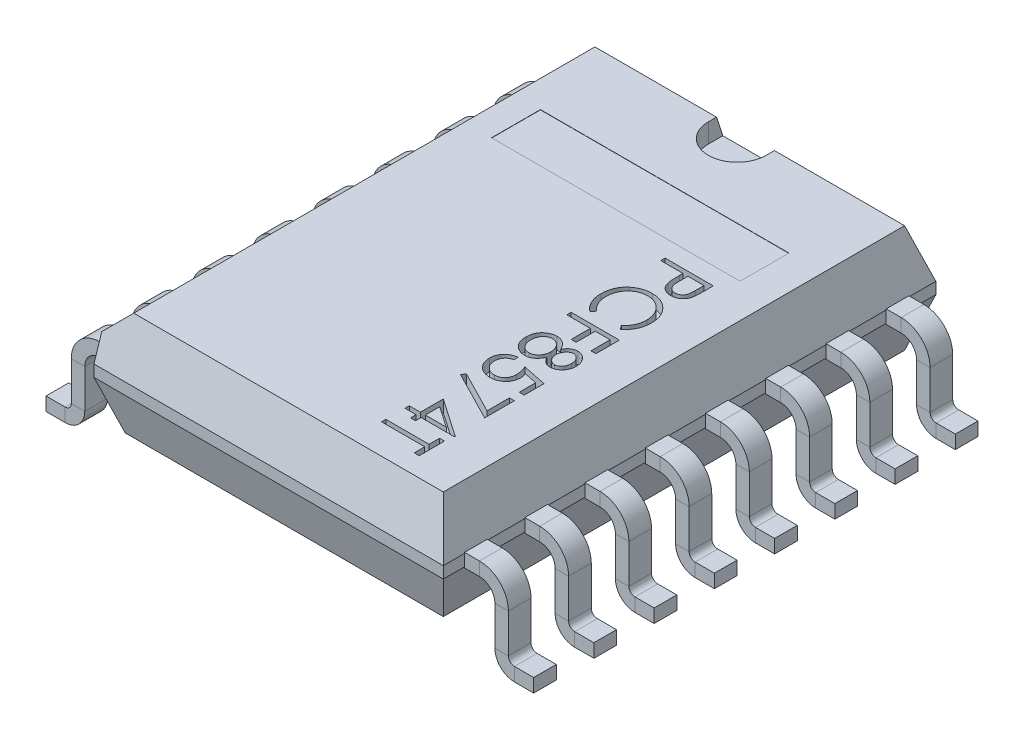
from build123d import *

# Parameters (mm, degrees)
SKETCH2_W               = 7.25
SKETCH2_H               = 10.22
BOSS_EXTRUDE1_DEPTH     = 0.24
SKETCH9_W               = 7.25
SKETCH9_H               = 10.22
BOSS_EXTRUDE3_DEPTH     = 1
SKETCH10_W              = 7.25
SKETCH10_H              = 10.22
BOSS_EXTRUDE4_DEPTH     = 1
BOSS_EXTRUDE4_TAPER     = 18
CUT_EXTRUDE1_DEPTH      = 0.4
CHAMFER1_START          = -5
CHAMFER1_DEPTH          = 8.625
CHAMFER1_START_2        = -6
CHAMFER1_2_DEPTH        = 12
CHAMFER2_START          = -4
CHAMFER2_OUTLINE_W      = 4
CHAMFER2_OUTLINE_H      = 12
CHAMFER2_DEPTH          = 0.9134789
SKETCH15_W              = 0.47
SKETCH15_H              = 0.28
LPATTERN1_COUNT         = 8
LPATTERN1_PITCH         = 1.25
MIRROR2_COPY_1_SKETCH_W = 0.47
MIRROR2_COPY_1_SKETCH_H = 0.28
MIRROR2_COPY_2_SKETCH_W = 0.47
MIRROR2_COPY_2_SKETCH_H = 0.28
MIRROR2_COPY_3_SKETCH_W = 0.47
MIRROR2_COPY_3_SKETCH_H = 0.28
MIRROR2_COPY_4_SKETCH_W = 0.47
MIRROR2_COPY_4_SKETCH_H = 0.28
MIRROR2_COPY_5_SKETCH_W = 0.47
MIRROR2_COPY_5_SKETCH_H = 0.28
MIRROR2_COPY_6_SKETCH_W = 0.47
MIRROR2_COPY_6_SKETCH_H = 0.28
MIRROR2_COPY_7_SKETCH_W = 0.47
MIRROR2_COPY_7_SKETCH_H = 0.28
SKETCH33_W              = 5.156105546
SKETCH33_H              = 1.012750295
CUT_EXTRUDE2_DEPTH      = 0.005
CUT_EXTRUDE3_DEPTH      = 0.25


with BuildPart() as part:
    # Sketch2 → Boss-Extrude1 (new body)
    with BuildSketch(Plane(origin=(0, 0, 0), x_dir=(1, 0, 0), z_dir=(0, 1, 0))):
        Rectangle(SKETCH2_W, SKETCH2_H)
    extrude(amount=BOSS_EXTRUDE1_DEPTH)

    # Sketch10 → Boss-Extrude4 (add)
    with BuildSketch(Plane.XZ):
        Rectangle(SKETCH10_W, SKETCH10_H)
    extrude(amount=BOSS_EXTRUDE4_DEPTH, taper=BOSS_EXTRUDE4_TAPER)



with BuildPart() as body_2:
    # Sketch9 → Boss-Extrude3 (new body)
    with BuildSketch(Plane(origin=(0, 0.24, 0), x_dir=(1, 0, 0), z_dir=(0, 1, 0))):
        Rectangle(SKETCH9_W, SKETCH9_H)
    extrude(amount=BOSS_EXTRUDE3_DEPTH)

    # Sketch12 → Cut-Extrude1 (cut)
    with BuildSketch(Plane(origin=(0, 1.24, 0), x_dir=(1, 0, 0), z_dir=(0, 1, 0))):
        with BuildLine():
            Line((0.600954319, 4.613520836), (0.600954319, 5.468733616))
            Line((0.600954319, 5.468733616), (-0.600954319, 5.468733616))
            Line((-0.600954319, 5.468733616), (-0.600954319, 4.613520836))
            ThreePointArc((-0.600954319, 4.613520836), (0, 4.012566516), (0.600954319, 4.613520836))
        make_face()
    extrude(amount=-CUT_EXTRUDE1_DEPTH, mode=Mode.SUBTRACT)

    # Chamfer1: read off the stored shape, not the designer's step
    # Chamfer1 outline → Chamfer1 (cut)
    with BuildSketch(Plane.YZ.offset(CHAMFER1_START)):
        Polygon((0.24, 5.11), (1.24, 4.785080304), (1.24, 5.11), align=None)
        Polygon((0.24, -5.11), (1.24, -5.11), (1.24, -4.785080304), align=None)
    extrude(amount=CHAMFER1_DEPTH, mode=Mode.SUBTRACT)

    # Chamfer1 2 outline → Chamfer1 2 (cut)
    with BuildSketch(Plane.XY.offset(CHAMFER1_START_2)):
        Polygon((3.300080304, 1.24), (3.625, 0.24), (3.625, 1.24), align=None)
    extrude(amount=CHAMFER1_2_DEPTH, mode=Mode.SUBTRACT)

    # Chamfer2: read off the stored shape, not the designer's step
    # Chamfer2 outline → Chamfer2 (cut)
    with BuildSketch(Plane(origin=(0, 0, 0), x_dir=(0.7071067811865471, 0.707106781186548, 0), z_dir=(0.707106781186548, -0.707106781186547, 0)).offset(CHAMFER2_START)):
        with Locations((-2, 0)):
            Rectangle(CHAMFER2_OUTLINE_W, CHAMFER2_OUTLINE_H)
    extrude(amount=CHAMFER2_DEPTH, mode=Mode.SUBTRACT)


with BuildPart() as part_1:
    add(part.part)

    add(body_2.part)  # Sweep1 merges body 2
    # Sweep1: sweep along a path in Sketch24
    with BuildLine(Plane.XY.offset(5.11)) as sweep1_path:
        Line((5.059235568, -1.412519405), (4.660907902, -1.412519405))
        ThreePointArc((4.660907902, -1.412519405), (4.472802819, -1.334603729), (4.394887143, -1.146498646))
        Line((4.394887143, -1.146498646), (4.394887143, -0.33960765))
        ThreePointArc((4.394887143, -0.33960765), (4.260271179, -0.014615964), (3.935279493, 0.12))
        Line((3.935279493, 0.12), (3.625, 0.12))
    # Sketch15 → Sweep1 (sweep)
    with BuildSketch(Plane(origin=(3.625, 0, 0), x_dir=(0, 0, -1), z_dir=(1, 0, 0))):
        with Locations((-4.435, 0.12)):
            Rectangle(SKETCH15_W, SKETCH15_H)
    sweep1 = sweep(path=sweep1_path.line)

    # LPattern1: Sweep1 ×8
    with Locations(*[(0, 0, -i * LPATTERN1_PITCH) for i in range(1, LPATTERN1_COUNT)]):
        add(sweep1)

    # Mirror2: Sweep1 across plane
    add(sweep1.mirror(Plane(origin=(0, 0, 0), x_dir=(0, 0, 1), z_dir=(1, 0, 0))))

    # Mirror2 copy 1: sweep along a path in Mirror2 copy 1 path
    with BuildLine(Plane(origin=(0, 0, 3.86), x_dir=(-1, 0, 0), z_dir=(0, 0, 1))) as mirror2_copy_1_path:
        Line((5.059235568, 1.412519405), (4.660907902, 1.412519405))
        ThreePointArc((4.660907902, 1.412519405), (4.472802819, 1.334603729), (4.394887143, 1.146498646))
        Line((4.394887143, 1.146498646), (4.394887143, 0.33960765))
        ThreePointArc((4.394887143, 0.33960765), (4.260271179, 0.014615964), (3.935279493, -0.12))
        Line((3.935279493, -0.12), (3.625, -0.12))
    # Mirror2 copy 1 sketch → Mirror2 copy 1 (sweep)
    with BuildSketch(Plane(origin=(-3.625, 0, -1.25), x_dir=(0, 0, -1), z_dir=(-1, 0, 0))):
        with Locations((-4.435, -0.12)):
            Rectangle(MIRROR2_COPY_1_SKETCH_W, MIRROR2_COPY_1_SKETCH_H)
    sweep(path=mirror2_copy_1_path.line)

    # Mirror2 copy 2: sweep along a path in Mirror2 copy 2 path
    with BuildLine(Plane(origin=(0, 0, 2.61), x_dir=(-1, 0, 0), z_dir=(0, 0, 1))) as mirror2_copy_2_path:
        Line((5.059235568, 1.412519405), (4.660907902, 1.412519405))
        ThreePointArc((4.660907902, 1.412519405), (4.472802819, 1.334603729), (4.394887143, 1.146498646))
        Line((4.394887143, 1.146498646), (4.394887143, 0.33960765))
        ThreePointArc((4.394887143, 0.33960765), (4.260271179, 0.014615964), (3.935279493, -0.12))
        Line((3.935279493, -0.12), (3.625, -0.12))
    # Mirror2 copy 2 sketch → Mirror2 copy 2 (sweep)
    with BuildSketch(Plane(origin=(-3.625, 0, -2.5), x_dir=(0, 0, -1), z_dir=(-1, 0, 0))):
        with Locations((-4.435, -0.12)):
            Rectangle(MIRROR2_COPY_2_SKETCH_W, MIRROR2_COPY_2_SKETCH_H)
    sweep(path=mirror2_copy_2_path.line)

    # Mirror2 copy 3: sweep along a path in Mirror2 copy 3 path
    with BuildLine(Plane(origin=(0, 0, 1.36), x_dir=(-1, 0, 0), z_dir=(0, 0, 1))) as mirror2_copy_3_path:
        Line((5.059235568, 1.412519405), (4.660907902, 1.412519405))
        ThreePointArc((4.660907902, 1.412519405), (4.472802819, 1.334603729), (4.394887143, 1.146498646))
        Line((4.394887143, 1.146498646), (4.394887143, 0.33960765))
        ThreePointArc((4.394887143, 0.33960765), (4.260271179, 0.014615964), (3.935279493, -0.12))
        Line((3.935279493, -0.12), (3.625, -0.12))
    # Mirror2 copy 3 sketch → Mirror2 copy 3 (sweep)
    with BuildSketch(Plane(origin=(-3.625, 0, -3.75), x_dir=(0, 0, -1), z_dir=(-1, 0, 0))):
        with Locations((-4.435, -0.12)):
            Rectangle(MIRROR2_COPY_3_SKETCH_W, MIRROR2_COPY_3_SKETCH_H)
    sweep(path=mirror2_copy_3_path.line)

    # Mirror2 copy 4: sweep along a path in Mirror2 copy 4 path
    with BuildLine(Plane(origin=(0, 0, 0.11), x_dir=(-1, 0, 0), z_dir=(0, 0, 1))) as mirror2_copy_4_path:
        Line((5.059235568, 1.412519405), (4.660907902, 1.412519405))
        ThreePointArc((4.660907902, 1.412519405), (4.472802819, 1.334603729), (4.394887143, 1.146498646))
        Line((4.394887143, 1.146498646), (4.394887143, 0.33960765))
        ThreePointArc((4.394887143, 0.33960765), (4.260271179, 0.014615964), (3.935279493, -0.12))
        Line((3.935279493, -0.12), (3.625, -0.12))
    # Mirror2 copy 4 sketch → Mirror2 copy 4 (sweep)
    with BuildSketch(Plane(origin=(-3.625, 0, -5), x_dir=(0, 0, -1), z_dir=(-1, 0, 0))):
        with Locations((-4.435, -0.12)):
            Rectangle(MIRROR2_COPY_4_SKETCH_W, MIRROR2_COPY_4_SKETCH_H)
    sweep(path=mirror2_copy_4_path.line)

    # Mirror2 copy 5: sweep along a path in Mirror2 copy 5 path
    with BuildLine(Plane(origin=(0, 0, -1.14), x_dir=(-1, 0, 0), z_dir=(0, 0, 1))) as mirror2_copy_5_path:
        Line((5.059235568, 1.412519405), (4.660907902, 1.412519405))
        ThreePointArc((4.660907902, 1.412519405), (4.472802819, 1.334603729), (4.394887143, 1.146498646))
        Line((4.394887143, 1.146498646), (4.394887143, 0.33960765))
        ThreePointArc((4.394887143, 0.33960765), (4.260271179, 0.014615964), (3.935279493, -0.12))
        Line((3.935279493, -0.12), (3.625, -0.12))
    # Mirror2 copy 5 sketch → Mirror2 copy 5 (sweep)
    with BuildSketch(Plane(origin=(-3.625, 0, -6.25), x_dir=(0, 0, -1), z_dir=(-1, 0, 0))):
        with Locations((-4.435, -0.12)):
            Rectangle(MIRROR2_COPY_5_SKETCH_W, MIRROR2_COPY_5_SKETCH_H)
    sweep(path=mirror2_copy_5_path.line)

    # Mirror2 copy 6: sweep along a path in Mirror2 copy 6 path
    with BuildLine(Plane(origin=(0, 0, -2.39), x_dir=(-1, 0, 0), z_dir=(0, 0, 1))) as mirror2_copy_6_path:
        Line((5.059235568, 1.412519405), (4.660907902, 1.412519405))
        ThreePointArc((4.660907902, 1.412519405), (4.472802819, 1.334603729), (4.394887143, 1.146498646))
        Line((4.394887143, 1.146498646), (4.394887143, 0.33960765))
        ThreePointArc((4.394887143, 0.33960765), (4.260271179, 0.014615964), (3.935279493, -0.12))
        Line((3.935279493, -0.12), (3.625, -0.12))
    # Mirror2 copy 6 sketch → Mirror2 copy 6 (sweep)
    with BuildSketch(Plane(origin=(-3.625, 0, -7.5), x_dir=(0, 0, -1), z_dir=(-1, 0, 0))):
        with Locations((-4.435, -0.12)):
            Rectangle(MIRROR2_COPY_6_SKETCH_W, MIRROR2_COPY_6_SKETCH_H)
    sweep(path=mirror2_copy_6_path.line)

    # Mirror2 copy 7: sweep along a path in Mirror2 copy 7 path
    with BuildLine(Plane(origin=(0, 0, -3.64), x_dir=(-1, 0, 0), z_dir=(0, 0, 1))) as mirror2_copy_7_path:
        Line((5.059235568, 1.412519405), (4.660907902, 1.412519405))
        ThreePointArc((4.660907902, 1.412519405), (4.472802819, 1.334603729), (4.394887143, 1.146498646))
        Line((4.394887143, 1.146498646), (4.394887143, 0.33960765))
        ThreePointArc((4.394887143, 0.33960765), (4.260271179, 0.014615964), (3.935279493, -0.12))
        Line((3.935279493, -0.12), (3.625, -0.12))
    # Mirror2 copy 7 sketch → Mirror2 copy 7 (sweep)
    with BuildSketch(Plane(origin=(-3.625, 0, -8.75), x_dir=(0, 0, -1), z_dir=(-1, 0, 0))):
        with Locations((-4.435, -0.12)):
            Rectangle(MIRROR2_COPY_7_SKETCH_W, MIRROR2_COPY_7_SKETCH_H)
    sweep(path=mirror2_copy_7_path.line)

    # Sketch33 → Cut-Extrude2 (cut)
    with BuildSketch(Plane(origin=(0, 1.24, 0), x_dir=(1, 0, 0), z_dir=(0, 1, 0))):
        with Locations((0.014185998, 2.586896118)):
            Rectangle(SKETCH33_W, SKETCH33_H)
    extrude(amount=-CUT_EXTRUDE2_DEPTH, mode=Mode.SUBTRACT)

    # Sketch36 → Cut-Extrude3 (cut)
    # profile 1 of 8: a face of its own
    with BuildSketch(Plane(origin=(0, 1.24, 0), x_dir=(1, 0, 0), z_dir=(0, 1, 0))):
        with BuildLine():
            Line((2.398118187, 1.718553058), (2.398118187, 1.522439276))
            add(Edge.make_bspline(
                [(2.398118187, 1.522439276), (2.39810336, 1.508950446), (2.39807495, 1.483105248), (2.397213594, 1.446043804), (2.39606311, 1.41238388), (2.394468284, 1.382198057), (2.392583543, 1.355393458), (2.389940104, 1.332091372), (2.387180019, 1.312108642), (2.384373903, 1.30013537), (2.383094149, 1.294674853)],
                knots=[0, 0, 0, 0, 1.415646017, 2.712440637, 3.8905458, 4.950247383, 5.884950622, 6.709939814, 7.411656543, 8, 8, 8, 8], degree=3))
            add(Edge.make_bspline(
                [(2.383094149, 1.294674853), (2.38120218, 1.287762399), (2.377462824, 1.274100373), (2.369972945, 1.254414597), (2.361093233, 1.23568405), (2.350968755, 1.217849702), (2.339185271, 1.201111414), (2.326115524, 1.185254925), (2.311766705, 1.170189287), (2.295860652, 1.156426275), (2.278983817, 1.143755656), (2.260760342, 1.132886186), (2.241586856, 1.12369205), (2.221266998, 1.116183241), (2.199924266, 1.11047365), (2.177496355, 1.106255223), (2.154060329, 1.103556222), (2.138042883, 1.103299255), (2.129889021, 1.103168443)],
                knots=[0, 0, 0, 0, 0.999487232, 1.975422798, 2.933948774, 3.889618007, 4.832992075, 5.786114792, 6.754729845, 7.731954186, 8.717668599, 9.695514499, 10.68728626, 11.680675814, 12.71351902, 13.766008651, 14.862761406, 16, 16, 16, 16], degree=3))
            add(Edge.make_bspline(
                [(2.129889021, 1.103168443), (2.121666799, 1.10328885), (2.105579466, 1.103524435), (2.082044384, 1.106351945), (2.059553415, 1.110160571), (2.038156429, 1.116016872), (2.017980495, 1.123687064), (1.998717286, 1.132684793), (1.980694522, 1.143537231), (1.963846774, 1.156007182), (1.948158228, 1.169879066), (1.933742572, 1.185094191), (1.92068419, 1.201591132), (1.908953806, 1.21931746), (1.898823441, 1.238445988), (1.889749925, 1.258686603), (1.882129622, 1.280215237), (1.878121033, 1.295113098), (1.876082931, 1.302687674)],
                knots=[0, 0, 0, 0, 1.121902311, 2.195077645, 3.232258892, 4.234102512, 5.217864754, 6.176164875, 7.132989551, 8.084763148, 9.034132444, 9.988522005, 10.94243251, 11.903244335, 12.886203696, 13.894208494, 14.929344452, 16, 16, 16, 16], degree=3))
            add(Edge.make_bspline(
                [(1.876082931, 1.302687674), (1.87475065, 1.308952626), (1.871830881, 1.322682634), (1.868571322, 1.345294841), (1.86578915, 1.371622094), (1.863703111, 1.401628459), (1.861917291, 1.435287004), (1.860497836, 1.472615934), (1.859717877, 1.513688528), (1.859677651, 1.542337455), (1.859656649, 1.557295046)],
                knots=[0, 0, 0, 0, 0.601384939, 1.31797006, 2.144135048, 3.087295005, 4.142315834, 5.309527816, 6.595305764, 8, 8, 8, 8], degree=3))
            Line((1.859656649, 1.557295046), (1.859656649, 1.628809469))
            Line((1.859656649, 1.628809469), (1.398118187, 1.628809469))
            Line((1.398118187, 1.628809469), (1.398118187, 1.718553058))
            Line((1.398118187, 1.718553058), (2.398118187, 1.718553058))
        make_face()
        with BuildLine():
            Line((2.295554085, 1.628809469), (1.962220751, 1.628809469))
            Line((1.962220751, 1.628809469), (1.960017226, 1.45372934))
            add(Edge.make_bspline(
                [(1.960017226, 1.45372934), (1.96001188, 1.445180707), (1.96000156, 1.428677745), (1.961155818, 1.404773365), (1.962429043, 1.382652509), (1.964422967, 1.362267137), (1.96705015, 1.343773036), (1.969909788, 1.326932655), (1.973784029, 1.311992529), (1.979186042, 1.294485437), (1.988219715, 1.27504341), (2.001670194, 1.254032972), (2.018344498, 1.235938703), (2.037349808, 1.22038532), (2.058569308, 1.20833149), (2.081094798, 1.199265473), (2.104940451, 1.19398457), (2.121250107, 1.193271976), (2.12948838, 1.192912033)],
                knots=[0, 0, 0, 0, 1.160368111, 2.240066715, 3.248291599, 4.168343349, 5.019594299, 5.784185847, 6.485545725, 7.113397927, 8.269509094, 9.383373363, 10.487084095, 11.595623793, 12.704274681, 13.786671823, 14.88201193, 16, 16, 16, 16], degree=3))
            add(Edge.make_bspline(
                [(2.12948838, 1.192912033), (2.13752733, 1.193273898), (2.153507769, 1.19399324), (2.176939489, 1.199307128), (2.199225992, 1.208313792), (2.220184254, 1.220466999), (2.239111784, 1.235573795), (2.255409774, 1.253267078), (2.268689775, 1.273185563), (2.277202115, 1.291723617), (2.282408155, 1.308179637), (2.286049132, 1.322474837), (2.288956577, 1.338614917), (2.29131068, 1.356605746), (2.293325967, 1.376307688), (2.294693386, 1.397890067), (2.295493803, 1.421271107), (2.295533504, 1.437502699), (2.295554085, 1.44591684)],
                knots=[0, 0, 0, 0, 1.120550889, 2.227516482, 3.330715807, 4.461473166, 5.594337325, 6.694900473, 7.802844763, 8.919519911, 9.52614448, 10.208195984, 10.975273469, 11.811520316, 12.738076669, 13.736566072, 14.826679847, 16, 16, 16, 16], degree=3))
            Line((2.295554085, 1.44591684), (2.295554085, 1.628809469))
        make_face(mode=Mode.SUBTRACT)
    # profile 2 of 8: a face of its own
    with BuildSketch(Plane(origin=(0, 1.24, 0), x_dir=(1, 0, 0), z_dir=(0, 1, 0))):
        with BuildLine():
            Line((2.214624597, -0.025036685), (2.154528444, 0.053488956))
            add(Edge.make_bspline(
                [(2.154528444, 0.053488956), (2.161204435, 0.059090638), (2.174466411, 0.07021848), (2.193089138, 0.088121109), (2.210536355, 0.106778722), (2.226891178, 0.126184185), (2.241581683, 0.14668679), (2.255373426, 0.167789876), (2.267735637, 0.18984646), (2.282725062, 0.220346956), (2.29836682, 0.260246341), (2.311482029, 0.310473438), (2.319830937, 0.36290518), (2.320735177, 0.398675923), (2.32119511, 0.416870366)],
                knots=[0, 0, 0, 0, 0.757959112, 1.505699292, 2.245454638, 2.979532153, 3.711538275, 4.438200793, 5.171680507, 5.909471876, 7.393775596, 8.890124382, 10.418191784, 12, 12, 12, 12], degree=3))
            add(Edge.make_bspline(
                [(2.32119511, 0.416870366), (2.321079172, 0.426894044), (2.32084837, 0.446848371), (2.317824877, 0.476464019), (2.313526381, 0.505582742), (2.307303416, 0.53409626), (2.299201679, 0.561947956), (2.289700505, 0.589349899), (2.277877257, 0.615979366), (2.264820059, 0.642156838), (2.250067825, 0.667235454), (2.233982035, 0.690969162), (2.21672057, 0.713249533), (2.198327986, 0.734138306), (2.1785757, 0.753406391), (2.157696075, 0.771362588), (2.135437799, 0.787683284), (2.112218307, 0.802769531), (2.08800347, 0.816193593), (2.06294562, 0.827785921), (2.037140563, 0.837721509), (2.010535435, 0.845656181), (1.983234933, 0.851914752), (1.955181121, 0.856238457), (1.926428451, 0.859234751), (1.906940102, 0.859463429), (1.897116585, 0.859578699)],
                knots=[0, 0, 0, 0, 1.055000685, 2.100209969, 3.131349012, 4.153242145, 5.170189196, 6.184191144, 7.204341339, 8.235672124, 9.263040994, 10.265373269, 11.252624173, 12.22887325, 13.193405896, 14.155809299, 15.126090485, 16.097288279, 17.069732292, 18.038585918, 19.002221264, 19.978698174, 20.959418239, 21.948869816, 22.966084182, 24, 24, 24, 24], degree=3))
            add(Edge.make_bspline(
                [(1.897116585, 0.859578699), (1.882336208, 0.85921818), (1.853316898, 0.858510347), (1.810811009, 0.852210823), (1.770090816, 0.84263794), (1.731410861, 0.828290632), (1.694294188, 0.810599475), (1.659368801, 0.788245014), (1.626106925, 0.762354575), (1.595294655, 0.732561884), (1.567147876, 0.699874508), (1.542361996, 0.664803676), (1.521700601, 0.627436737), (1.504507473, 0.588186271), (1.491291265, 0.546750238), (1.48198723, 0.503203152), (1.475918035, 0.457639725), (1.475336982, 0.42650561), (1.475041264, 0.41066043)],
                knots=[0, 0, 0, 0, 1.029171465, 2.020641659, 2.987623507, 3.938342917, 4.889210282, 5.84687017, 6.821220943, 7.821438502, 8.827599549, 9.822697543, 10.807740252, 11.797342354, 12.80366471, 13.83203677, 14.896651826, 16, 16, 16, 16], degree=3))
            add(Edge.make_bspline(
                [(1.475041264, 0.41066043), (1.475523773, 0.393202519), (1.476473465, 0.358841174), (1.484518965, 0.308450309), (1.497564084, 0.260211519), (1.515820633, 0.214122208), (1.539553573, 0.170312309), (1.568324395, 0.128713264), (1.602406775, 0.089289958), (1.628430526, 0.065583877), (1.641707931, 0.053488956)],
                knots=[0, 0, 0, 0, 1.028121516, 2.023589091, 2.998037872, 3.967518031, 4.937445131, 5.927275754, 6.942489185, 8, 8, 8, 8], degree=3))
            Line((1.641707931, 0.053488956), (1.582212738, -0.025036685))
            add(Edge.make_bspline(
                [(1.582212738, -0.025036685), (1.574058881, -0.018717234), (1.557790223, -0.0061086), (1.534855655, 0.0143081), (1.513282302, 0.035815435), (1.493248712, 0.058575938), (1.474336663, 0.082317395), (1.457180168, 0.107457999), (1.441256611, 0.133563523), (1.426869058, 0.160785958), (1.413969039, 0.189035927), (1.403078485, 0.218284033), (1.393562173, 0.248282484), (1.385784967, 0.279046386), (1.379705048, 0.310678515), (1.375642961, 0.343070338), (1.372859374, 0.376290233), (1.372605709, 0.398702077), (1.372477162, 0.410059469)],
                knots=[0, 0, 0, 0, 0.986756325, 1.968786143, 2.935506311, 3.899499537, 4.868307269, 5.8376204, 6.809456583, 7.792545619, 8.781780509, 9.778496008, 10.776623214, 11.79151764, 12.812666265, 13.856269958, 14.913646641, 16, 16, 16, 16], degree=3))
            add(Edge.make_bspline(
                [(1.372477162, 0.410059469), (1.372552017, 0.420814802), (1.372700033, 0.442082142), (1.375097795, 0.473481785), (1.378369149, 0.504050237), (1.3832949, 0.53370013), (1.389107569, 0.562593266), (1.396899357, 0.590467719), (1.40562769, 0.617597779), (1.415886257, 0.643874448), (1.42746231, 0.669320076), (1.440545612, 0.693852594), (1.455026145, 0.717460717), (1.470584719, 0.740376552), (1.487721091, 0.762261576), (1.506197273, 0.78330544), (1.52595099, 0.803626147), (1.540195234, 0.816198343), (1.547356969, 0.822519405)],
                knots=[0, 0, 0, 0, 1.114604814, 2.203992996, 3.262667896, 4.300477797, 5.318619304, 6.316056647, 7.298880507, 8.271930387, 9.238335007, 10.195173496, 11.151986948, 12.108099108, 13.064862484, 14.031167946, 15.010108607, 16, 16, 16, 16], degree=3))
            add(Edge.make_bspline(
                [(1.547356969, 0.822519405), (1.559797309, 0.832643874), (1.584527798, 0.852770582), (1.624609507, 0.878520777), (1.666457566, 0.900562936), (1.710291832, 0.918384627), (1.756013942, 0.932316837), (1.803646946, 0.941968607), (1.853146358, 0.948240494), (1.886814012, 0.948957719), (1.903927482, 0.949322289)],
                knots=[0, 0, 0, 0, 0.994628077, 1.977248131, 2.950237994, 3.925870899, 4.908910175, 5.911660606, 6.938484602, 8, 8, 8, 8], degree=3))
            add(Edge.make_bspline(
                [(1.903927482, 0.949322289), (1.921914002, 0.948875961), (1.957301357, 0.947997837), (2.009247513, 0.940598833), (2.05894399, 0.928551825), (2.106582006, 0.911963014), (2.151888997, 0.890077937), (2.195056312, 0.863584281), (2.236048704, 0.832223268), (2.274342082, 0.796388761), (2.309352393, 0.757081737), (2.340154409, 0.714991189), (2.365787921, 0.670196204), (2.387215413, 0.623191142), (2.403685255, 0.573623794), (2.415214738, 0.521599977), (2.422391057, 0.467217429), (2.423298259, 0.430113879), (2.423759213, 0.411261392)],
                knots=[0, 0, 0, 0, 1.032901378, 2.032168977, 3.007206631, 3.966850309, 4.924221947, 5.891988639, 6.871730993, 7.884084801, 8.900290346, 9.89161143, 10.874607481, 11.860025555, 12.854717796, 13.869097222, 14.917278314, 16, 16, 16, 16], degree=3))
            add(Edge.make_bspline(
                [(2.423759213, 0.411261392), (2.423621562, 0.39977152), (2.423349096, 0.377028476), (2.420688706, 0.343385188), (2.416261733, 0.310629037), (2.410196481, 0.278680809), (2.402762515, 0.247424653), (2.393030878, 0.217181232), (2.381730063, 0.187785861), (2.369046519, 0.159216523), (2.354546321, 0.131784045), (2.338797587, 0.105493419), (2.321436782, 0.080661794), (2.303037856, 0.056822084), (2.282912567, 0.034510997), (2.261716312, 0.013091334), (2.238820123, -0.006696989), (2.222704536, -0.018912263), (2.214624597, -0.025036685)],
                knots=[0, 0, 0, 0, 1.096705196, 2.170817488, 3.219277236, 4.250701065, 5.274195539, 6.284202015, 7.28098643, 8.279664616, 9.266225751, 10.241373748, 11.203306326, 12.157093976, 13.114198862, 14.069774147, 15.032234603, 16, 16, 16, 16], degree=3))
        make_face()
    # profile 3 of 8: a face of its own
    with BuildSketch(Plane(origin=(0, 1.24, 0), x_dir=(1, 0, 0), z_dir=(0, 1, 0))):
        Polygon((2.398118187, -0.23016489), (2.398118187, -0.717344377), (2.295554085, -0.717344377), (2.295554085, -0.31990848), (1.987861777, -0.31990848), (1.987861777, -0.717344377), (1.885297674, -0.717344377), (1.885297674, -0.31990848), (1.398118187, -0.31990848), (1.398118187, -0.23016489), align=None)
    # profile 4 of 8: a face of its own
    with BuildSketch(Plane(origin=(0, 1.24, 0), x_dir=(1, 0, 0), z_dir=(0, 1, 0))):
        with BuildLine():
            add(Edge.make_bspline(
                [(1.955209533, -1.293265852), (1.950936328, -1.301381951), (1.942576082, -1.317260569), (1.929157929, -1.339979859), (1.91514091, -1.36089713), (1.90096503, -1.38031048), (1.886069958, -1.397823942), (1.870625713, -1.413553404), (1.855045996, -1.427992339), (1.8387212, -1.44038164), (1.821988026, -1.451306723), (1.804702637, -1.460735691), (1.786919554, -1.468798563), (1.768440266, -1.475187758), (1.749537387, -1.480451186), (1.729966521, -1.484072772), (1.709856713, -1.486020467), (1.696265769, -1.486388698), (1.689384213, -1.486575147)],
                knots=[0, 0, 0, 0, 1.264385854, 2.473688339, 3.635349404, 4.734491366, 5.785876313, 6.801388178, 7.772322209, 8.711311751, 9.622826105, 10.524996139, 11.423212571, 12.31118177, 13.217849097, 14.126010572, 15.051135535, 16, 16, 16, 16], degree=3))
            add(Edge.make_bspline(
                [(1.689384213, -1.486575147), (1.679755628, -1.486356701), (1.660697046, -1.485924316), (1.632579198, -1.482095816), (1.605206066, -1.476508201), (1.57884229, -1.467807075), (1.553157498, -1.457414122), (1.528621316, -1.444044197), (1.504547652, -1.429040228), (1.489743614, -1.416964357), (1.482252803, -1.410853993)],
                knots=[0, 0, 0, 0, 1.02534174, 2.029536028, 3.018826961, 3.997522084, 4.983122576, 5.966563916, 6.971085759, 8, 8, 8, 8], degree=3))
            add(Edge.make_bspline(
                [(1.482252803, -1.410853993), (1.473511724, -1.402900715), (1.456137583, -1.387092439), (1.433580209, -1.360011602), (1.414623239, -1.330291064), (1.399174127, -1.298045826), (1.387149596, -1.263362083), (1.378508876, -1.226247224), (1.373559611, -1.186628895), (1.372844185, -1.15939876), (1.372477162, -1.145429313)],
                knots=[0, 0, 0, 0, 0.954267603, 1.896743057, 2.838368354, 3.796610408, 4.779680527, 5.799409237, 6.871065594, 8, 8, 8, 8], degree=3))
            add(Edge.make_bspline(
                [(1.372477162, -1.145429313), (1.372807325, -1.131997226), (1.373449788, -1.105859748), (1.377778889, -1.067810382), (1.385443051, -1.032299334), (1.395716114, -0.999158248), (1.409415476, -0.968707557), (1.426206934, -0.940892006), (1.445711216, -0.915303504), (1.468398378, -0.892746278), (1.492701305, -0.872721295), (1.517773021, -0.85513035), (1.543616881, -0.840509203), (1.569847261, -0.828130028), (1.596831879, -0.818653452), (1.624431882, -0.812089963), (1.652599066, -0.807921587), (1.67160811, -0.807366977), (1.681171072, -0.807087967)],
                knots=[0, 0, 0, 0, 1.256882982, 2.445766618, 3.576898315, 4.651879663, 5.686612882, 6.692806257, 7.686348993, 8.689277895, 9.678883454, 10.630458183, 11.551151498, 12.454054546, 13.341321255, 14.221808008, 15.105437234, 16, 16, 16, 16], degree=3))
            add(Edge.make_bspline(
                [(1.681171072, -0.807087967), (1.688187989, -0.807253068), (1.702055894, -0.807579366), (1.722544197, -0.809838009), (1.742486235, -0.813468571), (1.761953966, -0.818401423), (1.780811947, -0.825078723), (1.799126072, -0.833169759), (1.817037054, -0.842512673), (1.834236982, -0.853711178), (1.851299072, -0.866040187), (1.867389943, -0.880665195), (1.883405985, -0.8967054), (1.898654185, -0.914815704), (1.913867432, -0.934441796), (1.928077578, -0.956178527), (1.942324339, -0.979415196), (1.950840775, -0.995931264), (1.955209533, -1.004403672)],
                knots=[0, 0, 0, 0, 0.941717298, 1.86116577, 2.762973304, 3.660719123, 4.553575492, 5.444450535, 6.34648071, 7.261375261, 8.197060099, 9.168336537, 10.175980388, 11.237504102, 12.343496232, 13.506792996, 14.721035322, 16, 16, 16, 16], degree=3))
            add(Edge.make_bspline(
                [(1.955209533, -1.004403672), (1.961532768, -0.992804935), (1.973776319, -0.970346534), (1.996288752, -0.940628681), (2.02058192, -0.915061298), (2.047458719, -0.894635231), (2.075735394, -0.87842698), (2.105321333, -0.866981272), (2.135862272, -0.859507083), (2.15668899, -0.858750162), (2.167148636, -0.858370019)],
                knots=[0, 0, 0, 0, 1.16709546, 2.25982348, 3.287408737, 4.277418348, 5.234967981, 6.16072867, 7.076276605, 8, 8, 8, 8], degree=3))
            add(Edge.make_bspline(
                [(2.167148636, -0.858370019), (2.17780507, -0.858837292), (2.199226361, -0.859776592), (2.231113998, -0.867371687), (2.262432319, -0.879749408), (2.293033857, -0.896581766), (2.321866116, -0.917558078), (2.347812668, -0.942718954), (2.370344606, -0.971633877), (2.389380325, -1.00378946), (2.404950367, -1.038326161), (2.415579081, -1.074828361), (2.422569783, -1.112643756), (2.423359034, -1.138386453), (2.423759213, -1.151438929)],
                knots=[0, 0, 0, 0, 0.888753872, 1.786550278, 2.720173491, 3.693036334, 4.694165094, 5.687489879, 6.699912706, 7.744713188, 8.800178723, 9.852977058, 10.911381959, 12, 12, 12, 12], degree=3))
            add(Edge.make_bspline(
                [(2.423759213, -1.151438929), (2.423347742, -1.164154763), (2.422536368, -1.18922894), (2.415702935, -1.226140724), (2.404416726, -1.261487511), (2.389049153, -1.295076423), (2.369885327, -1.326173553), (2.347126082, -1.353938476), (2.321270699, -1.37829349), (2.292516525, -1.39852883), (2.261915729, -1.414858927), (2.23009034, -1.42648845), (2.197466825, -1.433885775), (2.175400085, -1.43482335), (2.164344149, -1.435293095)],
                knots=[0, 0, 0, 0, 1.072712831, 2.115267497, 3.156282165, 4.197922255, 5.225560591, 6.230883479, 7.219814004, 8.214446311, 9.19021444, 10.138875805, 11.067534608, 12, 12, 12, 12], degree=3))
            add(Edge.make_bspline(
                [(2.164344149, -1.435293095), (2.153493609, -1.43488328), (2.132183766, -1.434078425), (2.101119963, -1.427306174), (2.072024528, -1.415905505), (2.044588103, -1.400323854), (2.019190286, -1.380047194), (1.995915521, -1.35511026), (1.973838579, -1.326286949), (1.961558021, -1.304518926), (1.955209533, -1.293265852)],
                knots=[0, 0, 0, 0, 0.975287281, 1.915408787, 2.843441052, 3.776938647, 4.743139116, 5.754296123, 6.83907365, 8, 8, 8, 8], degree=3))
        make_face()
        with BuildLine():
            add(Edge.make_bspline(
                [(2.32119511, -1.146430916), (2.321008984, -1.1394164), (2.320644841, -1.12569294), (2.318742373, -1.105570462), (2.315041454, -1.0864355), (2.310116108, -1.068088128), (2.303462397, -1.050779896), (2.295635251, -1.034275738), (2.286119233, -1.018856541), (2.275444605, -1.004336169), (2.263703774, -0.991264519), (2.251471283, -0.979663218), (2.238506886, -0.970026614), (2.225133069, -0.96184344), (2.210952904, -0.955905864), (2.196401139, -0.95145892), (2.181293887, -0.948452808), (2.170969169, -0.948227554), (2.165746392, -0.948113608)],
                knots=[0, 0, 0, 0, 1.203892937, 2.355340988, 3.463153438, 4.544400666, 5.610487187, 6.640501085, 7.674077295, 8.714426146, 9.728707835, 10.68524104, 11.601827946, 12.495867327, 13.368432065, 14.231010473, 15.105153427, 16, 16, 16, 16], degree=3))
            add(Edge.make_bspline(
                [(2.165746392, -0.948113608), (2.160525743, -0.948316781), (2.150208989, -0.948718279), (2.134912963, -0.951624339), (2.12007729, -0.956483294), (2.105563478, -0.963145967), (2.091408779, -0.97169626), (2.077558954, -0.982073763), (2.06438025, -0.994728752), (2.051498762, -1.008703679), (2.039630858, -1.023968814), (2.029029795, -1.040009694), (2.020578722, -1.056943386), (2.013168857, -1.074262766), (2.0076106, -1.092334098), (2.003606203, -1.111032778), (2.001129233, -1.130338832), (2.00083245, -1.143418776), (2.00068229, -1.150036685)],
                knots=[0, 0, 0, 0, 0.873213166, 1.72559466, 2.594724523, 3.479581045, 4.391597569, 5.35687048, 6.368548091, 7.443976143, 8.534559525, 9.600545123, 10.654815915, 11.696401765, 12.749428718, 13.812189468, 14.893058657, 16, 16, 16, 16], degree=3))
            add(Edge.make_bspline(
                [(2.00068229, -1.150036685), (2.00093168, -1.158536715), (2.001427998, -1.17545282), (2.006042619, -1.200389772), (2.013301453, -1.224636242), (2.023232872, -1.247933071), (2.035697975, -1.269677239), (2.050621694, -1.289060115), (2.067659436, -1.30591637), (2.086545961, -1.32007083), (2.106646415, -1.331045072), (2.126817927, -1.339588446), (2.147275707, -1.344577365), (2.160980554, -1.345228098), (2.167749597, -1.345549506)],
                knots=[0, 0, 0, 0, 1.076279235, 2.141928126, 3.20205304, 4.278698113, 5.344010996, 6.36967002, 7.368914609, 8.37248503, 9.349703398, 10.264243087, 11.142681841, 12, 12, 12, 12], degree=3))
            add(Edge.make_bspline(
                [(2.167749597, -1.345549506), (2.172500694, -1.345397928), (2.18193094, -1.345097068), (2.195852817, -1.342605559), (2.209474177, -1.338520311), (2.222798319, -1.332885459), (2.236012606, -1.32590488), (2.248559177, -1.316887257), (2.261136278, -1.306650731), (2.273186533, -1.294759265), (2.284533315, -1.281353599), (2.294294465, -1.266222094), (2.302771866, -1.249749651), (2.309583574, -1.231801881), (2.314713855, -1.212448817), (2.318551688, -1.19176438), (2.320715755, -1.169580469), (2.32103186, -1.154314795), (2.32119511, -1.146430916)],
                knots=[0, 0, 0, 0, 0.814272661, 1.61621452, 2.416847352, 3.248328223, 4.093649164, 4.973549185, 5.892801723, 6.872536627, 7.872406081, 8.898230315, 9.953166191, 11.044090313, 12.18293744, 13.382234284, 14.648068262, 16, 16, 16, 16], degree=3))
        make_face(mode=Mode.SUBTRACT)
        with BuildLine():
            add(Edge.make_bspline(
                [(1.898118187, -1.152240211), (1.897960064, -1.143347097), (1.897649863, -1.125900979), (1.894194877, -1.100342307), (1.889389548, -1.075811191), (1.882083917, -1.052400001), (1.872663056, -1.030137436), (1.861136875, -1.008973349), (1.84771576, -0.988877791), (1.832326386, -0.970180029), (1.815659304, -0.953144419), (1.798240397, -0.937935898), (1.779944552, -0.925276514), (1.760934972, -0.91493215), (1.74123534, -0.906919085), (1.720849613, -0.901002327), (1.699716858, -0.897567736), (1.685389848, -0.897078318), (1.678166264, -0.896831557)],
                knots=[0, 0, 0, 0, 1.140506561, 2.237395584, 3.304560074, 4.345354409, 5.3782877, 6.402081073, 7.433555996, 8.474808822, 9.504965884, 10.489266388, 11.437701257, 12.354123303, 13.261162422, 14.161620169, 15.073101032, 16, 16, 16, 16], degree=3))
            add(Edge.make_bspline(
                [(1.678166264, -0.896831557), (1.66918543, -0.897219985), (1.651367666, -0.897990617), (1.625043891, -0.904137033), (1.599488009, -0.913924815), (1.575149682, -0.927913026), (1.552332096, -0.9448716), (1.532214408, -0.965588713), (1.514724911, -0.989254564), (1.500384435, -1.016105225), (1.48888115, -1.045394733), (1.481054081, -1.077199), (1.475833442, -1.111069003), (1.475309485, -1.134457856), (1.475041264, -1.146430916)],
                knots=[0, 0, 0, 0, 0.898956152, 1.783507998, 2.694187257, 3.631865312, 4.587204618, 5.533364321, 6.51415483, 7.525942309, 8.574485006, 9.65837228, 10.801290154, 12, 12, 12, 12], degree=3))
            add(Edge.make_bspline(
                [(1.475041264, -1.146430916), (1.47522072, -1.155788245), (1.475570358, -1.174019321), (1.478662975, -1.20061419), (1.483552833, -1.225716608), (1.490732965, -1.249314256), (1.499335199, -1.27168992), (1.510585099, -1.29234324), (1.523307806, -1.311824319), (1.538408558, -1.329218655), (1.554557967, -1.345037486), (1.571566223, -1.358892752), (1.589260107, -1.370618763), (1.607629998, -1.380071007), (1.626608201, -1.387577003), (1.64627267, -1.392987969), (1.666700632, -1.3963229), (1.680557406, -1.396660453), (1.687581328, -1.396831557)],
                knots=[0, 0, 0, 0, 1.22469164, 2.386092043, 3.500511288, 4.568136916, 5.611981868, 6.63276519, 7.641422348, 8.65223666, 9.641383647, 10.598487484, 11.519869765, 12.415254456, 13.298392158, 14.187051141, 15.081026348, 16, 16, 16, 16], degree=3))
            add(Edge.make_bspline(
                [(1.687581328, -1.396831557), (1.69440419, -1.396574439), (1.707857683, -1.396067448), (1.727779883, -1.392803795), (1.747105277, -1.387200069), (1.765750706, -1.379032939), (1.783917688, -1.36898844), (1.801471998, -1.356667521), (1.818274422, -1.341925849), (1.834342486, -1.325228512), (1.849205295, -1.307042446), (1.86235197, -1.287708395), (1.873424084, -1.267378702), (1.882428776, -1.246095458), (1.889510916, -1.223906168), (1.894458341, -1.200827085), (1.897572514, -1.176831207), (1.897934241, -1.160529816), (1.898118187, -1.152240211)],
                knots=[0, 0, 0, 0, 0.917481483, 1.809113215, 2.707052678, 3.61610275, 4.54058801, 5.494688304, 6.493986409, 7.541809048, 8.607637092, 9.648666143, 10.681335566, 11.715370464, 12.751897579, 13.808646822, 14.885650252, 16, 16, 16, 16], degree=3))
        make_face(mode=Mode.SUBTRACT)
    # profile 5 of 8: a face of its own
    with BuildSketch(Plane(origin=(0, 1.24, 0), x_dir=(1, 0, 0), z_dir=(0, 1, 0))):
        with BuildLine():
            Line((2.398118187, -2.204523865), (2.295554085, -2.204523865))
            Line((2.295554085, -2.204523865), (2.295554085, -1.864379634))
            Line((2.295554085, -1.864379634), (2.032533251, -1.810493416))
            add(Edge.make_bspline(
                [(2.032533251, -1.810493416), (2.035456186, -1.821080809), (2.04111891, -1.841592207), (2.047406273, -1.871866453), (2.0511964, -1.900607083), (2.051713917, -1.919257189), (2.051964341, -1.928281877)],
                knots=[0, 0, 0, 0, 1.100273476, 2.13160584, 3.095893838, 4, 4, 4, 4], degree=3))
            add(Edge.make_bspline(
                [(2.051964341, -1.928281877), (2.051722582, -1.939448622), (2.051247223, -1.961405231), (2.046684736, -1.993531192), (2.039498639, -2.024195744), (2.029476053, -2.053346496), (2.016577119, -2.081046235), (2.000673002, -2.107140274), (1.981873711, -2.131776496), (1.960360627, -2.15462922), (1.936654637, -2.175329055), (1.911249222, -2.193600864), (1.884121272, -2.208797112), (1.855390745, -2.221299294), (1.825105849, -2.231218567), (1.793042413, -2.237838735), (1.759484973, -2.24224204), (1.736540927, -2.242734354), (1.724840944, -2.242985403)],
                knots=[0, 0, 0, 0, 1.052772836, 2.070014431, 3.053871312, 4.019926262, 4.972333346, 5.930471369, 6.896690565, 7.89035727, 8.885779078, 9.861050232, 10.836829716, 11.812751485, 12.812646763, 13.836748493, 14.896881366, 16, 16, 16, 16], degree=3))
            add(Edge.make_bspline(
                [(1.724840944, -2.242985403), (1.716691727, -2.242795407), (1.700503424, -2.242417983), (1.67646238, -2.240498011), (1.652929559, -2.236803488), (1.629905313, -2.23183613), (1.607420423, -2.225414417), (1.585483069, -2.217556045), (1.5640257, -2.208292961), (1.543046912, -2.19783472), (1.523193448, -2.185736473), (1.504158839, -2.172992382), (1.486643599, -2.158875438), (1.470008305, -2.144069111), (1.454906251, -2.127981359), (1.440691155, -2.111111519), (1.427980492, -2.093063698), (1.416289551, -2.07416102), (1.405821936, -2.054415405), (1.397090076, -2.033626635), (1.389436525, -2.012251078), (1.383212617, -1.990098217), (1.378383764, -1.967210969), (1.375095381, -1.943510519), (1.372702795, -1.919115792), (1.372552886, -1.902580108), (1.372477162, -1.89422739)],
                knots=[0, 0, 0, 0, 1.05623316, 2.098192244, 3.122504159, 4.140841222, 5.148757784, 6.150489607, 7.158294732, 8.176043417, 9.185147859, 10.169157858, 11.142149047, 12.097904048, 13.0527185, 13.998867679, 14.954465986, 15.910220987, 16.877849176, 17.847023716, 18.829548819, 19.818454515, 20.826519638, 21.858115382, 22.918063636, 24, 24, 24, 24], degree=3))
            add(Edge.make_bspline(
                [(1.372477162, -1.89422739), (1.372674561, -1.884263351), (1.373062921, -1.86466028), (1.377125099, -1.835939944), (1.382944261, -1.808307835), (1.391694202, -1.781982636), (1.402674103, -1.75674224), (1.41646294, -1.732922646), (1.432306941, -1.710055669), (1.450752778, -1.688762806), (1.471103337, -1.669040559), (1.492950894, -1.65111475), (1.516382318, -1.635393923), (1.54119813, -1.621813922), (1.567441028, -1.610247109), (1.595189542, -1.601155995), (1.624304079, -1.593819628), (1.644347905, -1.590715752), (1.654528444, -1.589139249)],
                knots=[0, 0, 0, 0, 1.046825758, 2.059506013, 3.044032586, 4.011925612, 4.970610144, 5.93275819, 6.900651216, 7.891265644, 8.889116719, 9.876966323, 10.858259055, 11.851035124, 12.847502422, 13.86866322, 14.9174643, 16, 16, 16, 16], degree=3))
            Line((1.654528444, -1.589139249), (1.654528444, -1.678882839))
            add(Edge.make_bspline(
                [(1.654528444, -1.678882839), (1.644991404, -1.681089609), (1.626660686, -1.685331142), (1.600920982, -1.694665564), (1.577897071, -1.706008258), (1.557567216, -1.719802786), (1.539745933, -1.735925242), (1.523727509, -1.754190599), (1.509467726, -1.774859072), (1.49750499, -1.797817485), (1.487317587, -1.822052833), (1.480530411, -1.847414084), (1.475758983, -1.873215537), (1.475281303, -1.890666472), (1.475041264, -1.899435724)],
                knots=[0, 0, 0, 0, 1.136389429, 2.184203582, 3.172920998, 4.111012962, 5.028380909, 5.957351669, 6.927793475, 7.937618031, 8.960409703, 9.974842029, 10.982339866, 12, 12, 12, 12], degree=3))
            add(Edge.make_bspline(
                [(1.475041264, -1.899435724), (1.475275772, -1.907995279), (1.47573752, -1.924849114), (1.479291524, -1.949652367), (1.484765115, -1.973598903), (1.492956503, -1.996452433), (1.502912136, -2.018612873), (1.515687872, -2.039519665), (1.530390735, -2.05977763), (1.547235486, -2.078757096), (1.565798256, -2.096139796), (1.58564894, -2.111498688), (1.606825182, -2.124292092), (1.628960368, -2.135073266), (1.652297099, -2.143259923), (1.676726006, -2.149100203), (1.702307429, -2.152529648), (1.719755803, -2.153001414), (1.728647033, -2.153241813)],
                knots=[0, 0, 0, 0, 1.027316725, 2.022795036, 3.002884548, 3.971462791, 4.93288096, 5.914575861, 6.907176829, 7.935150275, 8.956128384, 9.956726525, 10.942570165, 11.921478529, 12.907843606, 13.90538589, 14.932640048, 16, 16, 16, 16], degree=3))
            add(Edge.make_bspline(
                [(1.728647033, -2.153241813), (1.73667351, -2.153083979), (1.7523932, -2.152774864), (1.775290105, -2.149339836), (1.797112189, -2.144527895), (1.817664304, -2.137139773), (1.837247406, -2.128011121), (1.855442345, -2.116429669), (1.87271658, -2.103190875), (1.888368354, -2.087684586), (1.902911714, -2.070775637), (1.915291356, -2.052071514), (1.925710801, -2.031998844), (1.934701331, -2.010789947), (1.941158778, -1.987942956), (1.946006719, -1.963909597), (1.948811116, -1.938430548), (1.949200226, -1.92101035), (1.949400238, -1.912055916)],
                knots=[0, 0, 0, 0, 1.045726679, 2.048034203, 3.01323695, 3.95502507, 4.889743367, 5.8246644, 6.761650845, 7.722168973, 8.692072792, 9.66525385, 10.638902184, 11.638179751, 12.663148338, 13.728659964, 14.832472288, 16, 16, 16, 16], degree=3))
            add(Edge.make_bspline(
                [(1.949400238, -1.912055916), (1.949239988, -1.904237481), (1.948911931, -1.88823193), (1.94633019, -1.863623424), (1.94235843, -1.83787611), (1.936633857, -1.810890028), (1.929466296, -1.782739238), (1.920514912, -1.753376925), (1.910204046, -1.722802378), (1.902206587, -1.702223519), (1.898118187, -1.691703352)],
                knots=[0, 0, 0, 0, 0.824638674, 1.688163388, 2.607705698, 3.571998603, 4.597075385, 5.671199175, 6.809488238, 8, 8, 8, 8], degree=3))
            Line((1.898118187, -1.691703352), (2.398118187, -1.794267454))
            Line((2.398118187, -1.794267454), (2.398118187, -2.204523865))
        make_face()
    # profile 6 of 8: a face of its own
    with BuildSketch(Plane(origin=(0, 1.24, 0), x_dir=(1, 0, 0), z_dir=(0, 1, 0))):
        Polygon((2.398118187, -2.40965207), (2.398118187, -3.025036685), (1.372477162, -2.49939566), (1.415145431, -2.421871621), (2.295554085, -2.873193736), (2.295554085, -2.40965207), align=None)
    # profile 7 of 8: a face of its own
    with BuildSketch(Plane(origin=(0, 1.24, 0), x_dir=(1, 0, 0), z_dir=(0, 1, 0))):
        Polygon((2.423759213, -3.660653672), (2.423759213, -3.678882839), (1.731451521, -3.678882839), (1.731451521, -3.794267454), (1.628887418, -3.794267454), (1.628887418, -3.678882839), (1.398118187, -3.678882839), (1.398118187, -3.589139249), (1.628887418, -3.589139249), (1.628887418, -3.114780275), align=None)
        Polygon((1.731451521, -3.589139249), (2.165746392, -3.589139249), (1.731451521, -3.291062326), align=None, mode=Mode.SUBTRACT)
    # profile 8 of 8: a face of its own
    with BuildSketch(Plane(origin=(0, 1.24, 0), x_dir=(1, 0, 0), z_dir=(0, 1, 0))):
        Polygon((2.295554085, -3.858370019), (2.398118187, -3.858370019), (2.398118187, -4.384011044), (2.295554085, -4.384011044), (2.295554085, -4.166062326), (1.398118187, -4.166062326), (1.398118187, -4.076318736), (2.295554085, -4.076318736), align=None)
    extrude(amount=-CUT_EXTRUDE3_DEPTH, mode=Mode.SUBTRACT)


solid = part_1.part
